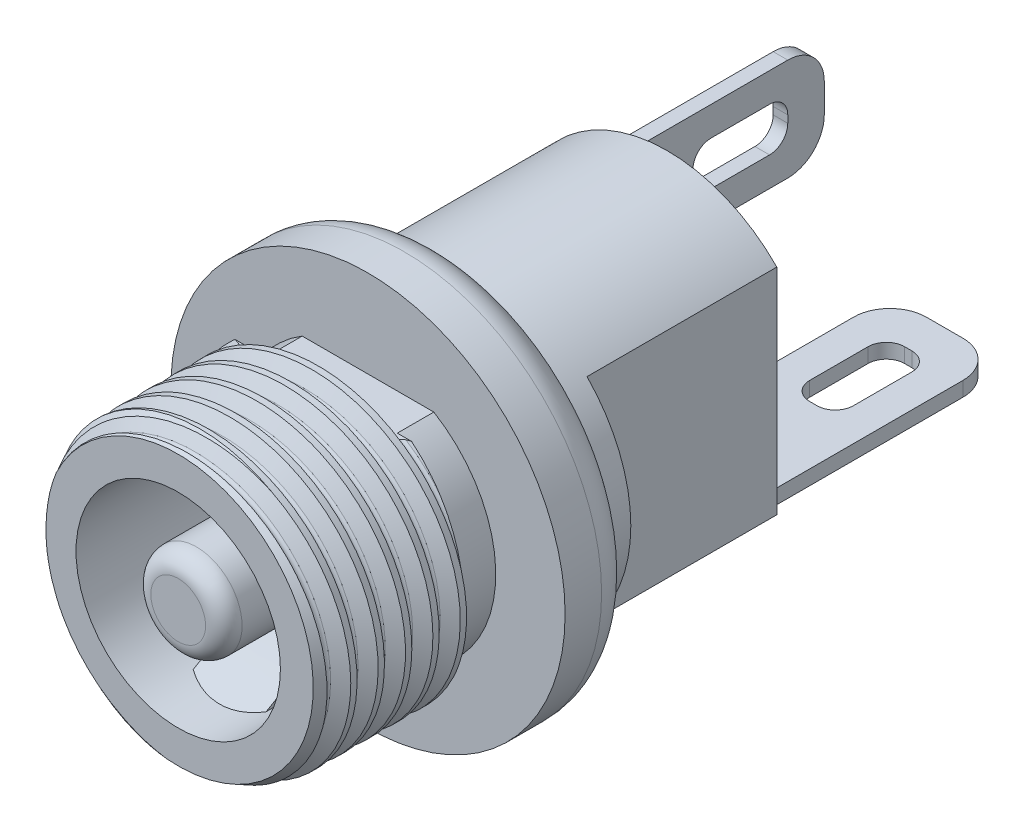
from build123d import *

# Parameters (mm, degrees)
SKETCH_1_R               = 5.4
EXTRUDE_1_DEPTH          = 2
SKETCH_2_R               = 3.5
EXTRUDE_2_DEPTH          = 1
SKETCH_15_R              = 4
EXTRUDE_8_DEPTH          = 4.2
SKETCH_3_R               = 4.2
EXTRUDE_3_DEPTH          = 6.2
EXTRUDE_4_DEPTH          = 1.5
EXTRUDE_4_DEPTH_BACK     = 1.5
SKETCH_12_R              = 0.75
EXTRUDE_7_DEPTH          = 0.4
CUT_EXTRUDE_1_DEPTH      = 1.5
EXTRUDE_6_DEPTH          = 1.4
EXTRUDE_6_DEPTH_BACK     = 1.4
SKETCH_10_W              = 0.4
SKETCH_10_H              = 8
CUT_EXTRUDE_4_DEPTH      = 1.4
FILLET_1_R               = 1
FILLET_3_R               = 1
CUT_EXTRUDE_2_DEPTH      = 18.548789163
CUT_EXTRUDE_2_DEPTH_BACK = 18.548789163
SKETCH_6_W               = 1.25
SKETCH_6_H               = 2.4
SKETCH_16_R              = 2.8
CUT_EXTRUDE_5_DEPTH      = 6
SKETCH_17_R              = 1.25
EXTRUDE_9_DEPTH          = 6
FILLET_4_R               = 0.5
CUT_EXTRUDE_6_DEPTH      = 18.548789163
CUT_EXTRUDE_6_DEPTH_BACK = 18.548789163
SKETCH_18_W              = 3
SKETCH_18_H              = 7
SKETCH_21_W              = 2
SKETCH_21_H              = 0.4
CHAMFER_1_SIZE           = 0.6
CHAMFER_1_SIZE2          = 0.3
SWEEP_1_2_PITCH          = 0.75


with BuildPart() as part:
    # Эскиз1 → Бобышка-Вытянуть1 (new body)
    with BuildSketch(Plane.XY):
        Circle(SKETCH_1_R)
    extrude(amount=-EXTRUDE_1_DEPTH)

    # Эскиз2 → Бобышка-Вытянуть2 (add)
    with BuildSketch(Plane.XY):
        Circle(SKETCH_2_R)
    extrude(amount=EXTRUDE_2_DEPTH)

    # Эскиз15 → Бобышка-Вытянуть8 (add)
    with BuildSketch(Plane.XY.offset(1)):
        Circle(SKETCH_15_R)
    extrude(amount=EXTRUDE_8_DEPTH)

    # Эскиз3 → Бобышка-Вытянуть3 (add)
    with BuildSketch(Plane(origin=(0, 0, -2), x_dir=(-1, 0, 0), z_dir=(0, 0, -1))):
        with Locations(Location((0, 0, 0), (0, 0, 180))):
            Circle(SKETCH_3_R)
    extrude(amount=EXTRUDE_3_DEPTH)

    # Эскиз4 → Бобышка-Вытянуть4 (add, two sides: drawn at the far end of the back side and taken through both)
    with BuildSketch(Plane(origin=(0, 0, 0), x_dir=(0, 0, -1), z_dir=(1, 0, 0)).offset(-EXTRUDE_4_DEPTH_BACK)):
        with BuildLine():
            Line((8.2, 1), (8.6, 1))
            Line((8.6, 1), (8.6, -2.8))
            ThreePointArc((8.6, -2.8), (8.892893219, -3.507106781), (9.6, -3.8))
            Line((9.6, -3.8), (15.8, -3.8))
            Line((15.8, -3.8), (15.8, -4.2))
            Line((15.8, -4.2), (9.6, -4.2))
            ThreePointArc((9.6, -4.2), (8.610050506, -3.789949494), (8.2, -2.8))
            Line((8.2, -2.8), (8.2, 1))
        make_face()
    extrude(amount=EXTRUDE_4_DEPTH + EXTRUDE_4_DEPTH_BACK)

    # Эскиз12 → Бобышка-Вытянуть7 (add)
    with BuildSketch(Plane(origin=(0, 0, -8.6), x_dir=(-1, 0, 0), z_dir=(0, 0, -1))):
        with Locations(Location((0, 0, 0), (0, 0, 90))):
            Circle(SKETCH_12_R)
    extrude(amount=EXTRUDE_7_DEPTH)

    # Эскиз5 → Вырез-Вытянуть1 (cut)
    with BuildSketch(Plane(origin=(0, -3.8, 0), x_dir=(1, 0, 0), z_dir=(0, 1, 0))):
        with BuildLine():
            Line((-0.1, 14.8), (0.1, 14.8))
            ThreePointArc((0.1, 14.8), (0.453553391, 14.653553391), (0.6, 14.3))
            Line((0.6, 14.3), (0.6, 12.7))
            ThreePointArc((0.6, 12.7), (0.453553391, 12.346446609), (0.1, 12.2))
            Line((0.1, 12.2), (-0.1, 12.2))
            ThreePointArc((-0.1, 12.2), (-0.453553391, 12.346446609), (-0.6, 12.7))
            Line((-0.6, 12.7), (-0.6, 14.3))
            ThreePointArc((-0.6, 14.3), (-0.453553391, 14.653553391), (-0.1, 14.8))
        make_face()
    extrude(amount=-CUT_EXTRUDE_1_DEPTH, mode=Mode.SUBTRACT)

    # Эскиз10 → Бобышка-Вытянуть6 (add, two sides: drawn at the far end of the back side and taken through both)
    with BuildSketch(Plane(origin=(0, 0, 0), x_dir=(1, 0, 0), z_dir=(0, 1, 0)).offset(-EXTRUDE_6_DEPTH_BACK)):
        with Locations((-3.5, 11.8)):
            Rectangle(SKETCH_10_W, SKETCH_10_H)
    extrude(amount=EXTRUDE_6_DEPTH + EXTRUDE_6_DEPTH_BACK)

    # Эскиз11 → Вырез-Вытянуть4 (cut)
    with BuildSketch(Plane.ZY.offset(3.7)):
        with BuildLine():
            Line((-14.3, 0.6), (-12.7, 0.6))
            ThreePointArc((-12.7, 0.6), (-12.346446609, 0.453553391), (-12.2, 0.1))
            Line((-12.2, 0.1), (-12.2, -0.1))
            ThreePointArc((-12.2, -0.1), (-12.346446609, -0.453553391), (-12.7, -0.6))
            Line((-12.7, -0.6), (-14.3, -0.6))
            ThreePointArc((-14.3, -0.6), (-14.653553391, -0.453553391), (-14.8, -0.1))
            Line((-14.8, -0.1), (-14.8, 0.1))
            ThreePointArc((-14.8, 0.1), (-14.653553391, 0.453553391), (-14.3, 0.6))
        make_face()
    extrude(amount=-CUT_EXTRUDE_4_DEPTH, mode=Mode.SUBTRACT)

    # Скругление1
    fillet_1_edges = [part.edges().sort_by_distance(p)[0] for p in [
        (-1.5, 1, -8.4),
        (-1.5, -4, -15.8),
        (1.5, -4, -15.8),
        (1.5, 1, -8.4),
        (-3.5, -1.4, -15.8),
        (-3.5, 1.4, -15.8),
    ]]
    fillet(fillet_1_edges, radius=FILLET_1_R)

    # Скругление3
    fillet_3_edges = [part.edges().sort_by_distance(p)[0] for p in [
        (-5.4, 0, -2),
    ]]
    fillet(fillet_3_edges, radius=FILLET_3_R)

    # Эскиз6 → Вырез-Вытянуть2 (cut, two sides: drawn at the far end of the back side and taken through both)
    with BuildSketch(Plane(origin=(0, 0, 0), x_dir=(0, 0, -1), z_dir=(1, 0, 0)).offset(-CUT_EXTRUDE_2_DEPTH_BACK)):
        with Locations((-0.625, 4.2)):
            Rectangle(SKETCH_6_W, SKETCH_6_H)
    extrude(amount=CUT_EXTRUDE_2_DEPTH + CUT_EXTRUDE_2_DEPTH_BACK, mode=Mode.SUBTRACT)

    # Эскиз16 → Вырез-Вытянуть5 (cut)
    with BuildSketch(Plane.XY.offset(5.2)):
        Circle(SKETCH_16_R)
    extrude(amount=-CUT_EXTRUDE_5_DEPTH, mode=Mode.SUBTRACT)

    # Эскиз17 → Бобышка-Вытянуть9 (add)
    with BuildSketch(Plane.XY.offset(-0.8)):
        Circle(SKETCH_17_R)
    extrude(amount=EXTRUDE_9_DEPTH)

    # Скругление4
    fillet_4_edges = [part.edges().sort_by_distance(p)[0] for p in [
        (-1.25, 0, 5.2),
    ]]
    fillet(fillet_4_edges, radius=FILLET_4_R)

    # Эскиз18 → Вырез-Вытянуть6 (cut, two sides: drawn at the far end of the back side and taken through both)
    with BuildSketch(Plane(origin=(0, 0, 0), x_dir=(1, 0, 0), z_dir=(0, 1, 0)).offset(-CUT_EXTRUDE_6_DEPTH_BACK)):
        with Locations((4.5, 6.5)):
            Rectangle(SKETCH_18_W, SKETCH_18_H)
    extrude(amount=CUT_EXTRUDE_6_DEPTH + CUT_EXTRUDE_6_DEPTH_BACK, mode=Mode.SUBTRACT)

    # Sweep 1: sweep along a path in Эскиз20
    with BuildLine() as sweep_1_path:  # in the path sketch's own coordinates; laid on its plane below (add() does not lay a ready-made edge on the line's plane)
        Line((0, -2), (-1, -2))
        add(Edge.make_bspline(
            [(-1, -2), (-2.652982213, -2.01026334), (-4, -3)],
            knots=[0, 0, 0, 1, 1, 1], degree=2))
    # Эскиз21 → Sweep 1 (sweep)
    with BuildSketch(Plane.XY):
        with Locations((0, -2)):
            Rectangle(SKETCH_21_W, SKETCH_21_H)
    sweep(path=Plane(origin=(0, 0, 0), x_dir=(0, 0, -1), z_dir=(1, 0, 0)) * sweep_1_path.line, transition=Transition.RIGHT)

    # Фаска1
    chamfer_1_edges = [part.edges().sort_by_distance(p)[0] for p in [
        (-4, 0, 5.2),
    ]]
    chamfer_1_side = [part.faces().sort_by_distance(p)[0] for p in [
        (-4, 0, 3.1),
    ]]
    chamfer(chamfer_1_edges, length=CHAMFER_1_SIZE, length2=CHAMFER_1_SIZE2, reference=chamfer_1_side[0])

    # Sweep 1 2: the profile of Эскиз13 screwed along a right-hand helix of 8.5 turns, 8 arcs to a turn; built about Z, then put on its axis
    sweep_1_2_z = Axis((0, 0, 0), (0, 0, 1))
    sweep_1_2_corners = [(4.5, 0, -0.577350269), (3.65, 0, -0.08660254), (3.6, 0, 0), (3.65, 0, 0.08660254), (4.5, 0, 0.577350269), (4.7, 0, 0.577350269), (4.7, 0, -0.577350269)]
    with BuildLine(mode=Mode.PRIVATE) as sweep_1_2_profile:
        Line(sweep_1_2_corners[0], sweep_1_2_corners[1])
        Line(sweep_1_2_corners[3], sweep_1_2_corners[4])
        Line(sweep_1_2_corners[4], sweep_1_2_corners[5])
        Line(sweep_1_2_corners[5], sweep_1_2_corners[6])
        Line(sweep_1_2_corners[6], sweep_1_2_corners[0])
        ThreePointArc((3.65, 0, -0.08660254), (3.61339746, 0, -0.05), (3.6, 0, 0))
        ThreePointArc((3.6, 0, 0), (3.61339746, 0, 0.05), (3.65, 0, 0.08660254))
    sweep_1_2_cap = Face(sweep_1_2_profile.wire())
    sweep_1_2_arcs = [((3.65, 0, -0.08660254), (3.6, 0, -0.057735027), (3.6, 0, 0), (1, 0.866025403784446, 1)), ((3.6, 0, 0), (3.6, 0, 0.057735027), (3.65, 0, 0.08660254), (1, 0.866025403784446, 1))]  # start, shoulder, end, weights
    sweep_1_2_turn_angles = [0, 22.5, 45, 67.5, 90, 112.5, 135, 157.5, 180, 202.5, 225, 247.5, 270, 292.5, 315, 337.5, 360]
    sweep_1_2_turn_weights = [1, 0.9238795325112867, 1, 0.9238795325112867, 1, 0.9238795325112867, 1, 0.9238795325112867, 1, 0.9238795325112867, 1, 0.9238795325112867, 1, 0.9238795325112867, 1, 0.9238795325112867, 1]
    sweep_1_2_turn_rails = [Edge.make_bspline([Vector(p[0], p[1], 0).rotate(sweep_1_2_z, sweep_1_2_turn_angles[k]) / sweep_1_2_turn_weights[k] + Vector(0, 0, p[2] + SWEEP_1_2_PITCH * sweep_1_2_turn_angles[k] / 360) for k in range(17)], [0, 0, 0, 1, 1, 2, 2, 3, 3, 4, 4, 5, 5, 6, 6, 7, 7, 8, 8, 8], 2, sweep_1_2_turn_weights) for p in sweep_1_2_corners]
    sweep_1_2_turn_sides = [*[Face.make_surface_from_curves(sweep_1_2_turn_rails[p[0]], sweep_1_2_turn_rails[p[1]]) for p in [(0, 1), (3, 4), (4, 5), (5, 6), (6, 0)]], *[Face.make_bezier_surface([[Vector(p[j][0], p[j][1], 0).rotate(sweep_1_2_z, sweep_1_2_turn_angles[2 * i + k]) / sweep_1_2_turn_weights[2 * i + k] + Vector(0, 0, p[j][2] + SWEEP_1_2_PITCH * sweep_1_2_turn_angles[2 * i + k] / 360) for k in range(3)] for j in range(3)], [[p[3][j] * sweep_1_2_turn_weights[2 * i + k] for k in range(3)] for j in range(3)]) for p in sweep_1_2_arcs for i in range(8)]]
    sweep_1_2_last_angles = [2880, 2902.5, 2925, 2947.5, 2970, 2992.5, 3015, 3037.5, 3060]
    sweep_1_2_last_weights = [1, 0.9238795325112867, 1, 0.9238795325112867, 1, 0.9238795325112867, 1, 0.9238795325112898, 1]
    sweep_1_2_last_rails = [Edge.make_bspline([Vector(p[0], p[1], 0).rotate(sweep_1_2_z, sweep_1_2_last_angles[k]) / sweep_1_2_last_weights[k] + Vector(0, 0, p[2] + SWEEP_1_2_PITCH * sweep_1_2_last_angles[k] / 360) for k in range(9)], [0, 0, 0, 1, 1, 2, 2, 3, 3, 4, 4, 4], 2, sweep_1_2_last_weights) for p in sweep_1_2_corners]
    sweep_1_2_last_sides = [*[Face.make_surface_from_curves(sweep_1_2_last_rails[p[0]], sweep_1_2_last_rails[p[1]]) for p in [(0, 1), (3, 4), (4, 5), (5, 6), (6, 0)]], *[Face.make_bezier_surface([[Vector(p[j][0], p[j][1], 0).rotate(sweep_1_2_z, sweep_1_2_last_angles[2 * i + k]) / sweep_1_2_last_weights[2 * i + k] + Vector(0, 0, p[j][2] + SWEEP_1_2_PITCH * sweep_1_2_last_angles[2 * i + k] / 360) for k in range(3)] for j in range(3)], [[p[3][j] * sweep_1_2_last_weights[2 * i + k] for k in range(3)] for j in range(3)]) for p in sweep_1_2_arcs for i in range(4)]]
    sweep_1_2 = Plane(origin=(0, 0, 7.2), x_dir=(0, 1, 0), z_dir=(0, 0, -1)) * Solid(Shell([*[p.moved(Location((0, 0, SWEEP_1_2_PITCH * i))) for i in range(8) for p in sweep_1_2_turn_sides], *sweep_1_2_last_sides, sweep_1_2_cap, sweep_1_2_cap.rotate(sweep_1_2_z, 3060).moved(Location((0, 0, SWEEP_1_2_PITCH * 3060 / 360)))]))
    add(sweep_1_2, mode=Mode.SUBTRACT)


solid = part.part
